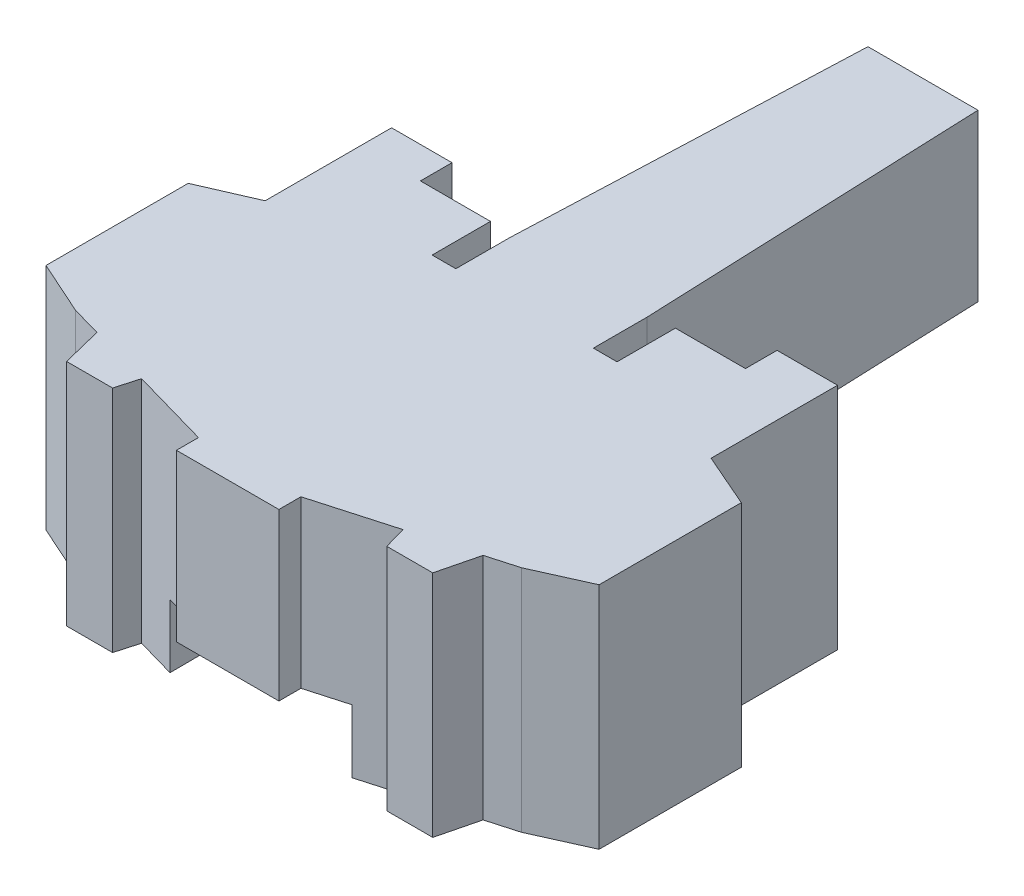
from build123d import *

# Parameters (mm, degrees)
BOSS_EXTRUDE1_DEPTH = 14.5
SKETCH2_R           = 2.5
CUT_EXTRUDE1_DEPTH  = 4


with BuildPart() as part:
    # Sketch1 → Boss-Extrude1 (new body)
    with BuildSketch(Plane(origin=(0, 0, 0), x_dir=(1, 0, 0), z_dir=(0, 1, 0))):
        Polygon((69.586467452, 65.357930026), (62.622760441, 65.357930026), (61.753444713, 43.538105233), (61.753444713, 40.147773891), (60.253444713, 40.147773891), (60.253444713, 43.839166535), (55.819934496, 43.839166535), (55.819934496, 45.839166535), (51.994945289, 45.839166535), (51.994945289, 37.839166535), (48.604613947, 36.361329796), (48.604613947, 27.361329796), (51.994945289, 25.839166535), (53.886066531, 25.301731423), (54.520425265, 22.751046211), (57.428168594, 22.751046211), (57.834181975, 24.179721996), (62.861391899, 22.751046211), (62.861391899, 21.357930026), (69.347835994, 21.357930026), (69.347835994, 22.751046211), (74.375045918, 24.179721996), (74.781059299, 22.751046211), (77.688802628, 22.751046211), (78.323161362, 25.301731423), (80.214282604, 25.839166535), (83.604613947, 27.361329796), (83.604613947, 36.361329796), (80.214282604, 37.839166535), (80.214282604, 45.839166535), (76.389293398, 45.839166535), (76.389293398, 43.839166535), (71.955783181, 43.839166535), (71.955783181, 40.147773891), (70.455783181, 40.147773891), (70.455783181, 43.538105233), align=None)
    extrude(amount=BOSS_EXTRUDE1_DEPTH)

    # Sketch2 → Cut-Extrude1 (cut)
    with BuildSketch(Plane(origin=(0, 0, 0), x_dir=(-1, 0, 0), z_dir=(0, -1, 0))):
        Polygon((-60.253444713, 40.147773891), (-60.347786937, 23.465384103), (-62.861391899, 22.751046211), (-62.861391899, 21.357930026), (-69.347835994, 21.357930026), (-69.347835994, 22.751046211), (-71.861440956, 23.465384103), (-71.955783181, 40.147773891), (-70.455783181, 40.147773891), (-70.455783181, 43.538105233), (-69.586467452, 65.357930026), (-62.622760441, 65.357930026), (-61.753444713, 43.538105233), (-61.753444713, 40.147773891), align=None)
        with Locations((-66.104613947, 40.807926742)):
            Circle(SKETCH2_R, mode=Mode.SUBTRACT)
    extrude(amount=-CUT_EXTRUDE1_DEPTH, mode=Mode.SUBTRACT)


solid = part.part
